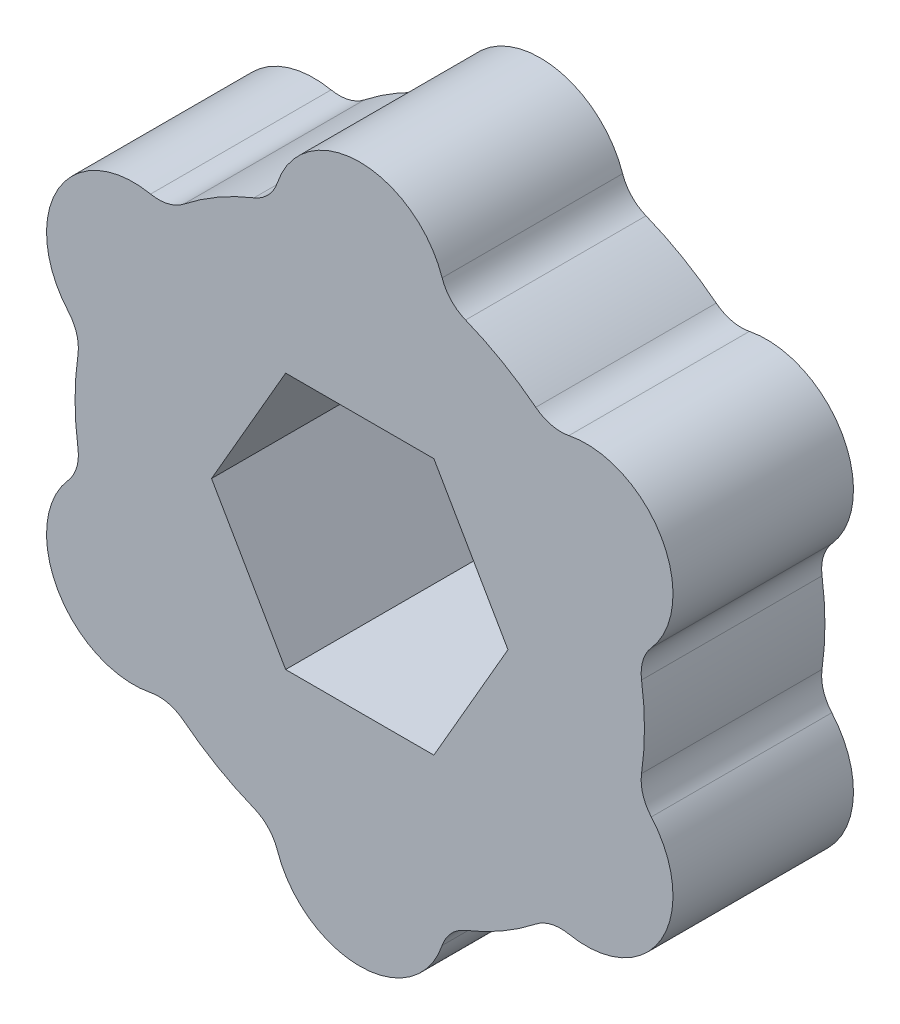
from build123d import *

# Parameters (mm, degrees)
BOSS_EXTRUDE2_DEPTH = 9.017
FILLET1_R           = 2.032
CUT_EXTRUDE1_DEPTH  = 26.078881193
SKETCH7_R           = 9.525
BOSS_EXTRUDE3_DEPTH = 1.778


with BuildPart() as part:
    # Sketch5 → Boss-Extrude2 (new body)
    with BuildSketch(Plane.XY):
        with BuildLine():
            ThreePointArc((13.895294195, -3.040226179), (14.224, 0), (13.895294195, 3.040226179))
            ThreePointArc((13.895294195, 3.040226179), (15.067976, 8.6995), (9.580560202, 10.513564677))
            ThreePointArc((9.580560202, 10.513564677), (7.112, 12.318345343), (4.314733993, 13.553790856))
            ThreePointArc((4.314733993, 13.553790856), (0, 17.399), (-4.314733993, 13.553790856))
            ThreePointArc((-4.314733993, 13.553790856), (-7.112, 12.318345343), (-9.580560202, 10.513564677))
            ThreePointArc((-9.580560202, 10.513564677), (-15.067976, 8.6995), (-13.895294195, 3.040226179))
            ThreePointArc((-13.895294195, 3.040226179), (-14.224, 0), (-13.895294195, -3.040226179))
            ThreePointArc((-13.895294195, -3.040226179), (-15.067976, -8.6995), (-9.580560202, -10.513564677))
            ThreePointArc((-9.580560202, -10.513564677), (-7.112, -12.318345343), (-4.314733993, -13.553790856))
            ThreePointArc((-4.314733993, -13.553790856), (0, -17.399), (4.314733993, -13.553790856))
            ThreePointArc((4.314733993, -13.553790856), (7.112, -12.318345343), (9.580560202, -10.513564677))
            ThreePointArc((9.580560202, -10.513564677), (15.067976, -8.6995), (13.895294195, -3.040226179))
        make_face()
    extrude(amount=BOSS_EXTRUDE2_DEPTH)

    # Fillet1
    fillet1_edges = [part.edges().sort_by_distance(p)[0] for p in [
        (-9.580560202, 10.513564677, 4.5085),
        (-4.314733993, 13.553790856, 4.5085),
        (4.314733993, 13.553790856, 4.5085),
        (9.580560202, 10.513564677, 4.5085),
        (13.895294195, 3.040226179, 4.5085),
        (13.895294195, -3.040226179, 4.5085),
        (9.580560202, -10.513564677, 4.5085),
        (4.314733993, -13.553790856, 4.5085),
        (-4.314733993, -13.553790856, 4.5085),
        (-9.580560202, -10.513564677, 4.5085),
        (-13.895294195, -3.040226179, 4.5085),
        (-13.895294195, 3.040226179, 4.5085),
    ]]
    fillet(fillet1_edges, radius=FILLET1_R)

    # Sketch6 → Cut-Extrude1 (cut, through all)
    with BuildSketch(Plane.XY.offset(9.017)):
        Polygon((7.405671903, 0), (3.702835951, 6.4135), (-3.702835951, 6.4135), (-7.405671903, 0), (-3.702835951, -6.4135), (3.702835951, -6.4135), align=None)
    extrude(amount=-CUT_EXTRUDE1_DEPTH, mode=Mode.SUBTRACT)

    # Sketch7 → Boss-Extrude3 (add)
    with BuildSketch(Plane(origin=(0, 0, 0), x_dir=(-1, 0, 0), z_dir=(0, 0, -1))):
        Circle(SKETCH7_R)
        Polygon((-7.405671903, 0), (-3.702835951, 6.4135), (3.702835951, 6.4135), (7.405671903, 0), (3.702835951, -6.4135), (-3.702835951, -6.4135), align=None, mode=Mode.SUBTRACT)
    extrude(amount=BOSS_EXTRUDE3_DEPTH)


solid = part.part
